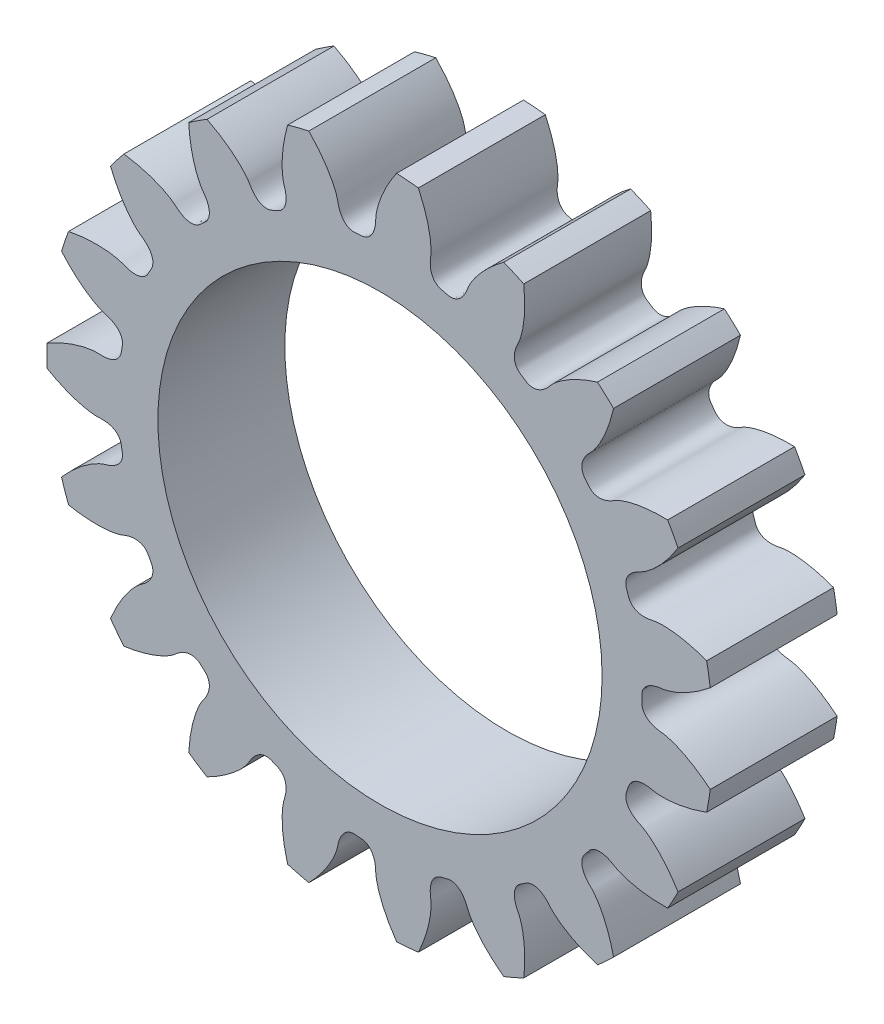
from build123d import *

# Parameters (mm, degrees)
SKETCHREVOLVESPURPINION_W       = 4
SKETCHREVOLVESPURPINION_H       = 10.499999842
TOOTHEXTRUDECUTSPURPINION_DEPTH = 2
PATTERNSPURPINION_COUNT         = 19
BOREREVOLVESKETCH_W             = 4
BOREREVOLVESKETCH_H             = 7


with BuildPart() as part:
    # SketchRevolveSpurPinion → SpurPinion (revolve)
    with BuildSketch(Plane(origin=(0, 0, 0), x_dir=(0, 0, -1), z_dir=(1, 0, 0))):
        with Locations((0, 5.249999921)):
            Rectangle(SKETCHREVOLVESPURPINION_W, SKETCHREVOLVESPURPINION_H)
    revolve(axis=Axis((0, 0, 0), (0, 0, -1)))

    # SketchToothSpurPinion → ToothExtrudeCutSpurPinion (cut, symmetric)
    with BuildSketch(Plane.XY):
        with BuildLine():
            ThreePointArc((10.453262131, 1.425414845), (10.549999842, 0), (10.453262131, -1.425414845))
            add(Edge.make_bspline(
                [(10.453262131, -1.425414845), (10.367326035, -1.353394637), (10.238669333, -1.251930275), (10.06564964, -1.128594361), (9.944090061, -1.047585267), (9.827560604, -0.975115164), (9.716470975, -0.910782508), (9.611210442, -0.85416847), (9.512147156, -0.804838071), (9.419627534, -0.762341023), (9.333975658, -0.726212752), (9.255492748, -0.69597514), (9.18445657, -0.671138213), (9.121121218, -0.651198945), (9.065715879, -0.635649067), (9.018446854, -0.623955761), (8.979490203, -0.615621666), (8.949010683, -0.610024033), (8.878787982, -0.599777793), (8.800543269, -0.593138323), (8.714424347, -0.574156579), (8.664508232, -0.560968978), (8.616505827, -0.545516093), (8.57026023, -0.527710712), (8.525615161, -0.507231311), (8.482414686, -0.483648426), (8.440551516, -0.456336336), (8.400050156, -0.42444098), (8.361222153, -0.386864097), (8.32489058, -0.342351194), (8.292714702, -0.289772335), (8.267151791, -0.228753234), (8.253099937, -0.165661214), (8.247308524, -0.088583022), (8.251745547, 0), (8.247308524, 0.088583022), (8.253099937, 0.165661214), (8.267151791, 0.228753234), (8.292714702, 0.289772335), (8.32489058, 0.342351194), (8.361222153, 0.386864097), (8.400050156, 0.42444098), (8.440551516, 0.456336336), (8.482414686, 0.483648426), (8.525615161, 0.507231311), (8.57026023, 0.527710712), (8.616505827, 0.545516093), (8.664508232, 0.560968978), (8.714424347, 0.574156579), (8.800543269, 0.593138323), (8.878787982, 0.599777793), (8.949010683, 0.610024033), (8.979490203, 0.615621666), (9.018446854, 0.623955761), (9.065715879, 0.635649067), (9.121121218, 0.651198945), (9.18445657, 0.671138213), (9.255492748, 0.69597514), (9.333975658, 0.726212752), (9.419627534, 0.762341023), (9.512147156, 0.804838071), (9.611210442, 0.85416847), (9.716470975, 0.910782508), (9.827560604, 0.975115164), (9.944090061, 1.047585267), (10.06564964, 1.128594361), (10.238669333, 1.251930275), (10.367326035, 1.353394637), (10.453262131, 1.425414845)],
                knots=[0, 0, 0, 0, 0.060396063, 0.088210039, 0.114434645, 0.139069881, 0.162115748, 0.183572244, 0.20343937, 0.221717126, 0.238405512, 0.253504528, 0.267014174, 0.278934451, 0.289265357, 0.298006893, 0.305159059, 0.310721856, 0.314695284, 0.343384638, 0.352907201, 0.362159078, 0.371188538, 0.380055981, 0.388837197, 0.397627176, 0.406543928, 0.415730909, 0.425354803, 0.435592533, 0.44659872, 0.458447759, 0.471062798, 0.481230687, 0.5, 0.518769313, 0.528937202, 0.541552241, 0.55340128, 0.564407467, 0.574645197, 0.584269091, 0.593456072, 0.602372824, 0.611162803, 0.619944019, 0.628811462, 0.637840922, 0.647092799, 0.656615362, 0.685304716, 0.689278144, 0.694840941, 0.701993107, 0.710734643, 0.721065549, 0.732985826, 0.746495472, 0.761594488, 0.778282874, 0.79656063, 0.816427756, 0.837884252, 0.860930119, 0.885565355, 0.911789961, 0.939603937, 1, 1, 1, 1], degree=3))
        make_face()
    toothextrudecutspurpinion = extrude(amount=TOOTHEXTRUDECUTSPURPINION_DEPTH, both=True, mode=Mode.SUBTRACT)

    # PatternSpurPinion: ToothExtrudeCutSpurPinion ×19 about axis
    patternspurpinion_axis = Axis((0, 0, 55), (0, 0, -1))
    for i in range(1, PATTERNSPURPINION_COUNT):
        add(toothextrudecutspurpinion.rotate(patternspurpinion_axis, i * 360 / PATTERNSPURPINION_COUNT), mode=Mode.SUBTRACT)

    # BoreRevolveSketch → BoreRevolveCut (revolve, cut)
    with BuildSketch(Plane(origin=(0, 0, 0), x_dir=(0, 0, -1), z_dir=(1, 0, 0))):
        with Locations((0, 3.5)):
            Rectangle(BOREREVOLVESKETCH_W, BOREREVOLVESKETCH_H)
    revolve(axis=Axis((0, 0, 0), (0, 0, -1)), mode=Mode.SUBTRACT)


solid = part.part
